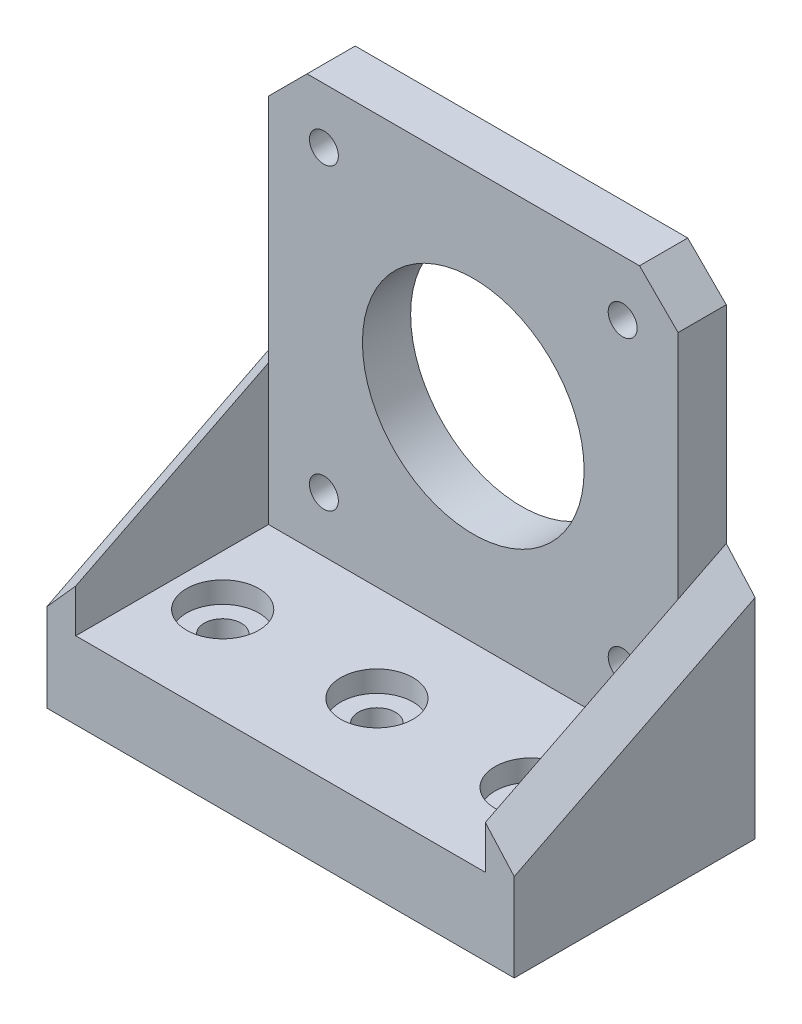
from build123d import *

# Parameters (mm, degrees)
SKETCH1_W           = 42.5
SKETCH1_H           = 42.5
SKETCH1_R           = 1.5
SKETCH1_R_2         = 11.5
BOSS_EXTRUDE1_DEPTH = 5
CHAMFER1_SIZE       = 4
SKETCH2_W           = 42.5
SKETCH2_H           = 25
BOSS_EXTRUDE2_DEPTH = 8
BOSS_EXTRUDE3_DEPTH = 3
SKETCH4_R           = 3.75
CUT_EXTRUDE1_DEPTH  = 2.2
SKETCH5_R           = 1.925
CUT_EXTRUDE2_DEPTH  = 57.667031862


with BuildPart() as part:
    # Sketch1 → Boss-Extrude1 (new body)
    with BuildSketch(Plane.XY):
        Rectangle(SKETCH1_W, SKETCH1_H)
        with Locations((15.5, 15.5)):
            Circle(SKETCH1_R, mode=Mode.SUBTRACT)
        with Locations(Location((-15.5, 15.5, 0), (0, 0, 180))):
            Circle(SKETCH1_R, mode=Mode.SUBTRACT)
        with Locations(Location((15.5, -15.5, 0), (0, 0, 180))):
            Circle(SKETCH1_R, mode=Mode.SUBTRACT)
        with Locations((-15.5, -15.5)):
            Circle(SKETCH1_R, mode=Mode.SUBTRACT)
        Circle(SKETCH1_R_2, mode=Mode.SUBTRACT)
    extrude(amount=BOSS_EXTRUDE1_DEPTH)

    # Chamfer1
    chamfer1_edges = [part.edges().sort_by_distance(p)[0] for p in [
        (-21.25, 21.25, 2.5),
        (21.25, 21.25, 2.5),
    ]]
    chamfer(chamfer1_edges, length=CHAMFER1_SIZE)

    # Sketch2 → Boss-Extrude2 (add)
    with BuildSketch(Plane.XZ.offset(21.25)):
        with Locations((0, 12.5)):
            Rectangle(SKETCH2_W, SKETCH2_H)
    extrude(amount=BOSS_EXTRUDE2_DEPTH)

    # Sketch3 → Boss-Extrude3 (add)
    with BuildSketch(Plane(origin=(21.25, 0, 0), x_dir=(0, 0, -1), z_dir=(1, 0, 0))):
        Polygon((-25, -21.25), (0, -8.681713823), (0, -29.25), (-25, -29.25), align=None)
    boss_extrude3 = extrude(amount=BOSS_EXTRUDE3_DEPTH)

    # Mirror3: Boss-Extrude3 across plane
    add(boss_extrude3.mirror(Plane(origin=(0, 0, 0), x_dir=(0, 0, 1), z_dir=(1, 0, 0))))

    # Chamfer2
    # the kernel refuses this chamfer: 4 mm, written as the material it adds along each edge
    with BuildSketch(Plane(origin=(-21.25, -22.284423421, 27.057606356), x_dir=(-0.9996219169112968, -0.02456616062709099, -0.012350181481602638), z_dir=(0, 0.44916485684431295, -0.8934488969023511))) as chamfer2_piece_1_section:
        with BuildLine():
            Line((4.114692781, 0), (-0.22618862, 4.108471174))
            Line((-0.22618862, 4.108471174), (-0.306158373, 4.106271504))
            ThreePointArc((-0.306158373, 4.106271504), (-0.136516908, 2.053591319), (-0.079969753, -0.00219967))
            Line((-0.079969753, -0.00219967), (0.00219967, -0.079969753))
            ThreePointArc((0.00219967, -0.079969753), (2.057990659, -0.023422598), (4.116892451, -0.079969753))
            Line((4.116892451, -0.079969753), (4.114692781, 0))
        make_face()
    chamfer2_piece_1 = extrude(amount=54.972604346, mode=Mode.PRIVATE)
    chamfer2_piece_1 = split(chamfer2_piece_1, bisect_by=Plane(origin=(-24.25, -14.705039529, 15), z_dir=(1, 0, 0)), keep=Keep.TOP, mode=Mode.PRIVATE)
    chamfer2_piece_1 = split(chamfer2_piece_1, bisect_by=Plane(origin=(-22.462839724, -14.705039529, 25), z_dir=(0, 0, -1)), keep=Keep.TOP, mode=Mode.PRIVATE)
    chamfer2_piece_1 = split(chamfer2_piece_1, bisect_by=Plane(origin=(-21.25, -14.705039529, 15), z_dir=(-1, 0, 0)), keep=Keep.TOP, mode=Mode.PRIVATE)
    chamfer2_piece_1 = split(chamfer2_piece_1, bisect_by=Plane(origin=(-22.462839724, -14.705039529, 5), z_dir=(0, 0, 1)), keep=Keep.TOP, mode=Mode.PRIVATE)
    add(chamfer2_piece_1)
    with BuildSketch(Plane(origin=(-21.25, -22.284423421, 27.057606356), x_dir=(-0.9996219169112968, -0.02456616062709099, -0.012350181481602638), z_dir=(0, 0.44916485684431295, -0.8934488969023511))) as chamfer2_piece_2_section:
        with BuildLine():
            Line((4.114692781, 0), (-0.22618862, 4.108471174))
            Line((-0.22618862, 4.108471174), (-0.306158373, 4.106271504))
            ThreePointArc((-0.306158373, 4.106271504), (-0.136516908, 2.053591319), (-0.079969753, -0.00219967))
            Line((-0.079969753, -0.00219967), (0.00219967, -0.079969753))
            ThreePointArc((0.00219967, -0.079969753), (2.057990659, -0.023422598), (4.116892451, -0.079969753))
            Line((4.116892451, -0.079969753), (4.114692781, 0))
        make_face()
    chamfer2_piece_2 = extrude(amount=54.972604346, mode=Mode.PRIVATE)
    chamfer2_piece_2 = split(chamfer2_piece_2, bisect_by=Plane(origin=(-24.25, -8.42089644, 2.5), z_dir=(1, 0, 0)), keep=Keep.TOP, mode=Mode.PRIVATE)
    chamfer2_piece_2 = split(chamfer2_piece_2, bisect_by=Plane(origin=(-22.462839724, -8.42089644, 0), z_dir=(0, 0, 1)), keep=Keep.TOP, mode=Mode.PRIVATE)
    chamfer2_piece_2 = split(chamfer2_piece_2, bisect_by=Plane(origin=(-21.25, -8.42089644, 2.5), z_dir=(-1, 0, 0)), keep=Keep.TOP, mode=Mode.PRIVATE)
    chamfer2_piece_2 = split(chamfer2_piece_2, bisect_by=Plane(origin=(-22.462839724, -8.42089644, 5), z_dir=(0, 0, -1)), keep=Keep.TOP, mode=Mode.PRIVATE)
    add(chamfer2_piece_2)
    with BuildSketch(Plane(origin=(-21.25, -22.284423421, 27.057606356), x_dir=(-0.9996219169112968, -0.02456616062709099, -0.012350181481602638), z_dir=(0, 0.44916485684431295, -0.8934488969023511))) as chamfer2_piece_3_section:
        with BuildLine():
            Line((4.114692781, 0), (-0.22618862, 4.108471174))
            Line((-0.22618862, 4.108471174), (-0.306158373, 4.106271504))
            ThreePointArc((-0.306158373, 4.106271504), (-0.136516908, 2.053591319), (-0.079969753, -0.00219967))
            Line((-0.079969753, -0.00219967), (0.00219967, -0.079969753))
            ThreePointArc((0.00219967, -0.079969753), (2.057990659, -0.023422598), (4.116892451, -0.079969753))
            Line((4.116892451, -0.079969753), (4.114692781, 0))
        make_face()
    chamfer2_piece_3 = extrude(amount=54.972604346, mode=Mode.PRIVATE)
    chamfer2_piece_3 = split(chamfer2_piece_3, bisect_by=Plane(origin=(-21.193688037, -7.24875826, 0), z_dir=(0, 0, 1)), keep=Keep.TOP, mode=Mode.PRIVATE)
    chamfer2_piece_3 = split(chamfer2_piece_3, bisect_by=Plane(origin=(-21.25, -7.24875826, 2.5), z_dir=(1, 0, 0)), keep=Keep.TOP, mode=Mode.PRIVATE)
    chamfer2_piece_3 = split(chamfer2_piece_3, bisect_by=Plane(origin=(-21.193688037, -7.24875826, 5), z_dir=(0, 0, -1)), keep=Keep.TOP, mode=Mode.PRIVATE)
    add(chamfer2_piece_3)
    with BuildSketch(Plane(origin=(21.25, -22.284423421, 27.057606356), x_dir=(-0.027495876610586504, 0.8931110989838116, 0.4489950352079003), z_dir=(0, 0.44916485684431295, -0.8934488969023511))) as chamfer2_piece_4_section:
        with BuildLine():
            Line((4.114692781, 0), (-0.22618862, 4.108471174))
            Line((-0.22618862, 4.108471174), (-0.306158373, 4.106271504))
            ThreePointArc((-0.306158373, 4.106271504), (-0.136516908, 2.053591319), (-0.079969753, -0.00219967))
            Line((-0.079969753, -0.00219967), (0.00219967, -0.079969753))
            ThreePointArc((0.00219967, -0.079969753), (2.057990659, -0.023422598), (4.116892451, -0.079969753))
            Line((4.116892451, -0.079969753), (4.114692781, 0))
        make_face()
    chamfer2_piece_4 = extrude(amount=54.972604346, mode=Mode.PRIVATE)
    chamfer2_piece_4 = split(chamfer2_piece_4, bisect_by=Plane(origin=(22.462839724, -14.705039529, 5), z_dir=(0, 0, 1)), keep=Keep.TOP, mode=Mode.PRIVATE)
    chamfer2_piece_4 = split(chamfer2_piece_4, bisect_by=Plane(origin=(22.462839724, -14.705039529, 25), z_dir=(0, 0, -1)), keep=Keep.TOP, mode=Mode.PRIVATE)
    chamfer2_piece_4 = split(chamfer2_piece_4, bisect_by=Plane(origin=(21.25, -14.705039529, 15), z_dir=(1, 0, 0)), keep=Keep.TOP, mode=Mode.PRIVATE)
    chamfer2_piece_4 = split(chamfer2_piece_4, bisect_by=Plane(origin=(24.25, -14.705039529, 15), z_dir=(-1, 0, 0)), keep=Keep.TOP, mode=Mode.PRIVATE)
    add(chamfer2_piece_4)
    with BuildSketch(Plane(origin=(21.25, -22.284423421, 27.057606356), x_dir=(-0.027495876610586504, 0.8931110989838116, 0.4489950352079003), z_dir=(0, 0.44916485684431295, -0.8934488969023511))) as chamfer2_piece_5_section:
        with BuildLine():
            Line((4.114692781, 0), (-0.22618862, 4.108471174))
            Line((-0.22618862, 4.108471174), (-0.306158373, 4.106271504))
            ThreePointArc((-0.306158373, 4.106271504), (-0.136516908, 2.053591319), (-0.079969753, -0.00219967))
            Line((-0.079969753, -0.00219967), (0.00219967, -0.079969753))
            ThreePointArc((0.00219967, -0.079969753), (2.057990659, -0.023422598), (4.116892451, -0.079969753))
            Line((4.116892451, -0.079969753), (4.114692781, 0))
        make_face()
    chamfer2_piece_5 = extrude(amount=54.972604346, mode=Mode.PRIVATE)
    chamfer2_piece_5 = split(chamfer2_piece_5, bisect_by=Plane(origin=(21.193688037, -7.24875826, 0), z_dir=(0, 0, 1)), keep=Keep.TOP, mode=Mode.PRIVATE)
    chamfer2_piece_5 = split(chamfer2_piece_5, bisect_by=Plane(origin=(21.193688037, -7.24875826, 5), z_dir=(0, 0, -1)), keep=Keep.TOP, mode=Mode.PRIVATE)
    chamfer2_piece_5 = split(chamfer2_piece_5, bisect_by=Plane(origin=(21.25, -7.24875826, 2.5), z_dir=(-1, 0, 0)), keep=Keep.TOP, mode=Mode.PRIVATE)
    add(chamfer2_piece_5)
    with BuildSketch(Plane(origin=(21.25, -22.284423421, 27.057606356), x_dir=(-0.027495876610586504, 0.8931110989838116, 0.4489950352079003), z_dir=(0, 0.44916485684431295, -0.8934488969023511))) as chamfer2_piece_6_section:
        with BuildLine():
            Line((4.114692781, 0), (-0.22618862, 4.108471174))
            Line((-0.22618862, 4.108471174), (-0.306158373, 4.106271504))
            ThreePointArc((-0.306158373, 4.106271504), (-0.136516908, 2.053591319), (-0.079969753, -0.00219967))
            Line((-0.079969753, -0.00219967), (0.00219967, -0.079969753))
            ThreePointArc((0.00219967, -0.079969753), (2.057990659, -0.023422598), (4.116892451, -0.079969753))
            Line((4.116892451, -0.079969753), (4.114692781, 0))
        make_face()
    chamfer2_piece_6 = extrude(amount=54.972604346, mode=Mode.PRIVATE)
    chamfer2_piece_6 = split(chamfer2_piece_6, bisect_by=Plane(origin=(22.462839724, -8.42089644, 0), z_dir=(0, 0, 1)), keep=Keep.TOP, mode=Mode.PRIVATE)
    chamfer2_piece_6 = split(chamfer2_piece_6, bisect_by=Plane(origin=(22.462839724, -8.42089644, 5), z_dir=(0, 0, -1)), keep=Keep.TOP, mode=Mode.PRIVATE)
    chamfer2_piece_6 = split(chamfer2_piece_6, bisect_by=Plane(origin=(21.25, -8.42089644, 2.5), z_dir=(1, 0, 0)), keep=Keep.TOP, mode=Mode.PRIVATE)
    chamfer2_piece_6 = split(chamfer2_piece_6, bisect_by=Plane(origin=(24.25, -8.42089644, 2.5), z_dir=(-1, 0, 0)), keep=Keep.TOP, mode=Mode.PRIVATE)
    add(chamfer2_piece_6)

    # Sketch4 → Cut-Extrude1 (cut)
    with BuildSketch(Plane(origin=(0, -21.25, 0), x_dir=(1, 0, 0), z_dir=(0, 1, 0))):
        with Locations(Location((0, -15, 0), (0, 0, 270))):
            Circle(SKETCH4_R)
        with Locations(Location((16, -15, 0), (0, 0, 270))):
            Circle(SKETCH4_R)
        with Locations(Location((-16, -15, 0), (0, 0, 270))):
            Circle(SKETCH4_R)
    extrude(amount=-CUT_EXTRUDE1_DEPTH, mode=Mode.SUBTRACT)

    # Sketch5 → Cut-Extrude2 (cut, through all)
    with BuildSketch(Plane(origin=(0, -23.45, 0), x_dir=(1, 0, 0), z_dir=(0, 1, 0))):
        with Locations(Location((0, -15, 0), (0, 0, 270))):
            Circle(SKETCH5_R)
        with Locations(Location((16, -15, 0), (0, 0, 270))):
            Circle(SKETCH5_R)
        with Locations(Location((-16, -15, 0), (0, 0, 270))):
            Circle(SKETCH5_R)
    extrude(amount=-CUT_EXTRUDE2_DEPTH, mode=Mode.SUBTRACT)


solid = part.part
